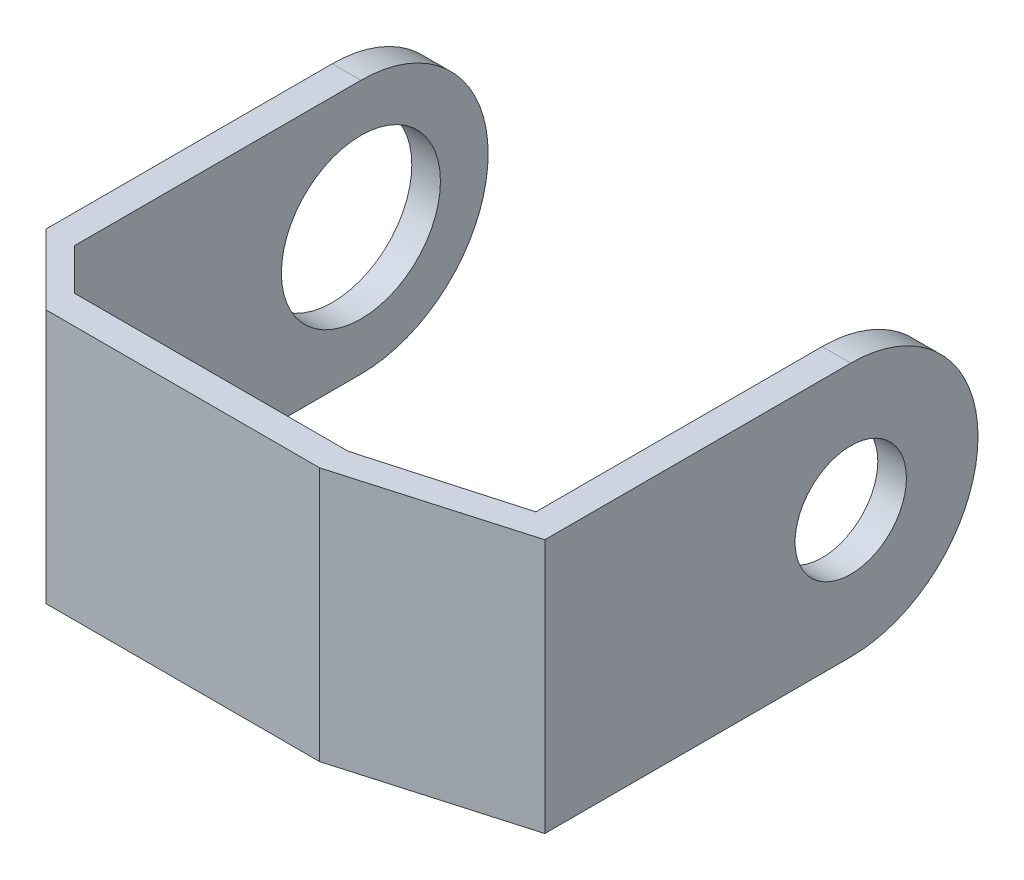
from build123d import *

# Parameters (mm, degrees)
EXTRUDE_1_DEPTH     = 16
FILLET_2_R          = 8
SKETCH_2_R          = 5
CUT_EXTRUDE_1_DEPTH = 2
SKETCH_3_R          = 3.5
CUT_EXTRUDE_2_DEPTH = 2


with BuildPart() as part:
    # 草图1 → 凸台-拉伸1 (new body)
    with BuildSketch(Plane(origin=(0, 0, 0), x_dir=(1, 0, 0), z_dir=(0, 1, 0))):
        Polygon((-8.6, 0), (8.6, 0), (17.8, 2.6), (17.8, 28.6), (19.6, 28.6), (19.6, 2.6), (19.6, 1.363414634), (8.6, -1.8), (-8.6, -1.8), (-13, 2.6), (-13, 28.6), (-11.2, 28.6), (-11.2, 2.6), align=None)
    extrude(amount=EXTRUDE_1_DEPTH)

    # 圆角2
    fillet_2_edges = [part.edges().sort_by_distance(p)[0] for p in [
        (18.7, 0, -28.6),
        (18.7, 16, -28.6),
        (-12.1, 0, -28.6),
        (-12.1, 16, -28.6),
    ]]
    fillet(fillet_2_edges, radius=FILLET_2_R - 0.0001)  # a hair under: the kernel refuses the full size

    # 草图2 → 切除-拉伸1 (cut)
    with BuildSketch(Plane.ZY.offset(13)):
        with Locations((-20.6, 8)):
            Circle(SKETCH_2_R)
    extrude(amount=-CUT_EXTRUDE_1_DEPTH, mode=Mode.SUBTRACT)

    # 草图3 → 切除-拉伸2 (cut)
    with BuildSketch(Plane(origin=(19.6, 0, 0), x_dir=(0, 0, -1), z_dir=(1, 0, 0))):
        with Locations((20.6, 8)):
            Circle(SKETCH_3_R)
    extrude(amount=-CUT_EXTRUDE_2_DEPTH, mode=Mode.SUBTRACT)


solid = part.part
